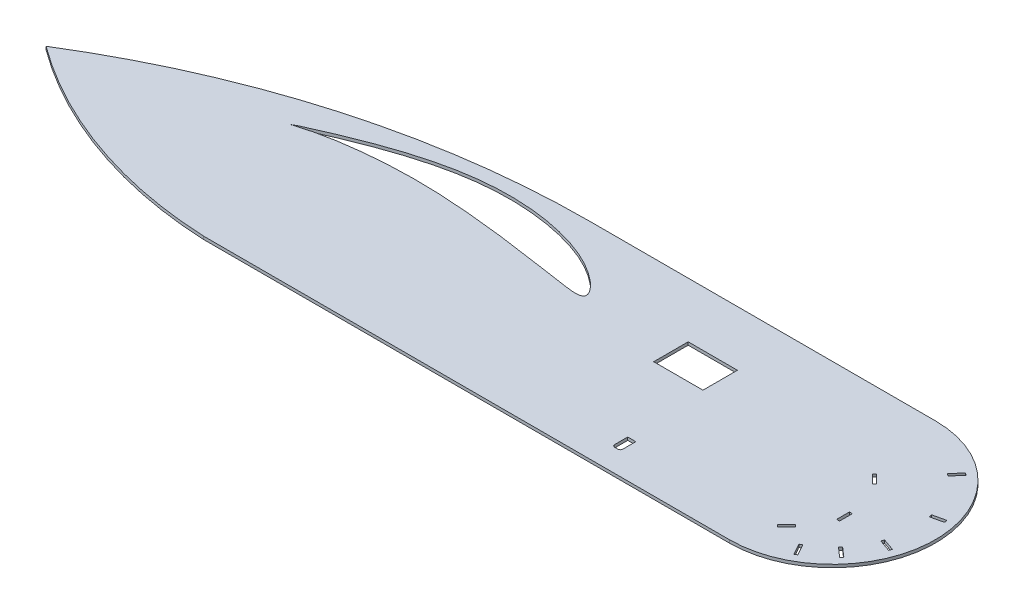
from build123d import *

# Parameters (mm, degrees)
BOSS_EXTRUDE1_DEPTH = 3
SKETCH2_W           = 50
SKETCH2_H           = 35
SKETCH2_W_2         = 3
SKETCH2_H_2         = 13
CUT_EXTRUDE1_DEPTH  = 929.337357861


with BuildPart() as part:
    # Sketch1 → Boss-Extrude1 (new body)
    with BuildSketch(Plane(origin=(0, 0, 0), x_dir=(1, 0, 0), z_dir=(0, 1, 0))):
        with BuildLine():
            Line((266.408252791, 0), (800, 0))
            ThreePointArc((800, 0), (904.5, 104.5), (800, 209))
            Line((800, 209), (449.013868906, 209))
            ThreePointArc((449.013868906, 209), (225.712962473, 177.880412497), (19.429068043, 86.893169221))
            ThreePointArc((19.429068043, 86.893169221), (136.475600537, 25.133273094), (266.408252791, 0))
        make_face()
    extrude(amount=BOSS_EXTRUDE1_DEPTH)

    # Sketch2 → Cut-Extrude1 (cut, through all)
    with BuildSketch(Plane.XZ):
        with Locations((630.07, -135.5)):
            Rectangle(SKETCH2_W, SKETCH2_H)
        Polygon((823.689305431, -121.232773416), (814.496917276, -130.425161571), (816.618237619, -132.546481915), (825.810625775, -123.354093759), align=None)
        Polygon((841.707638324, -32.736946498), (848.035754927, -21.381113624), (845.41517811, -19.920779024), (839.087061507, -31.276611897), align=None)
        with Locations((837.956551938, -78.816857662)):
            Rectangle(SKETCH2_W_2, SKETCH2_H_2)
        with BuildLine():
            Line((212.57, -142.261782597), (212.57, -142.294782597))
            add(Edge.make_bspline(
                [(212.57, -142.294782597), (212.815137814, -142.460102486), (213.721483955, -143.071338431), (215.664179604, -144.220627165), (218.723437449, -145.777902142), (222.783765044, -147.580430449), (227.75908382, -149.780753256), (233.673151887, -152.372942719), (243.334631626, -156.473964415), (254.071597155, -160.928560196), (265.811315632, -165.551386352), (275.559769605, -169.192616013), (285.820264156, -172.789650289), (300.213165162, -177.442893994), (315.047470761, -181.61442891), (330.216772764, -185.078244178), (341.716798025, -187.262793988), (353.238408154, -188.970546018), (364.74982071, -190.189827969), (376.222154657, -190.889317525), (387.611451467, -191.086885836), (398.853751386, -190.764655348), (413.421420996, -189.696341642), (427.580802498, -187.700042396), (441.195366572, -184.827458978), (450.821943115, -182.319735681), (459.948918056, -179.469695278), (468.511745548, -176.287644359), (476.453624938, -172.824739179), (483.715148146, -169.128859345), (490.24814377, -165.284833696), (496.019667562, -161.40694583), (500.998027396, -157.585747413), (505.147593549, -153.884087589), (508.447339472, -150.382728864), (510.852240131, -147.180842115), (512.23052565, -144.518995071), (512.672376723, -142.438033672), (512.365957104, -140.693980261), (510.836297954, -139.267947677), (508.300825673, -138.604557497), (504.990749494, -138.396901122), (500.845143819, -138.632879923), (495.886387834, -139.207005807), (490.127383335, -140.033765729), (483.600688534, -141.01415409), (476.345974836, -142.081971784), (468.41886468, -143.270863791), (459.86962452, -144.552957933), (447.40415706, -146.414008038), (434.302787697, -148.29198326), (413.230560269, -151.080307043), (394.916461571, -153.170522792), (372.413070638, -155.185169178), (353.278576878, -156.497400442), (334.10390548, -157.12050793), (318.83753012, -157.119300437), (307.569298967, -156.863067348), (296.54483902, -156.342386113), (285.853643217, -155.59861473), (275.586288909, -154.654588864), (265.829573747, -153.556930461), (256.673464041, -152.312824912), (248.205041684, -150.95854436), (240.510067524, -149.523302558), (233.666056009, -148.064077742), (227.735558734, -146.629571507), (222.771530443, -145.20558608), (218.774640723, -143.912633605), (215.724793866, -142.995242016), (213.753356987, -142.496728121), (212.816237246, -142.310670921), (212.57, -142.261782597)],
                knots=[0, 0, 0, 0, 0.001413477, 0.005226038, 0.010781091, 0.017815608, 0.026460951, 0.036790889, 0.048685593, 0.076639155, 0.092362872, 0.109003461, 0.126386903, 0.144339126, 0.181312719, 0.200023431, 0.218712626, 0.237261299, 0.255692478, 0.274037197, 0.292192583, 0.310132767, 0.327788163, 0.362001934, 0.378421226, 0.394286639, 0.40954344, 0.424114253, 0.43793778, 0.450941833, 0.463044023, 0.474154417, 0.484164575, 0.493023962, 0.500713088, 0.507125739, 0.512129705, 0.514904185, 0.517171427, 0.520261618, 0.5242453, 0.529497961, 0.536092185, 0.54406114, 0.553363127, 0.563904543, 0.575614949, 0.588420092, 0.60222661, 0.616944448, 0.648675826, 0.665501113, 0.718564132, 0.736789145, 0.773513212, 0.810244924, 0.828488569, 0.846493195, 0.864125178, 0.88124851, 0.897725282, 0.913415058, 0.928184346, 0.941897285, 0.954411455, 0.965602702, 0.975349728, 0.983575522, 0.990284579, 0.99543259, 0.998799869, 1, 1, 1, 1], degree=3))
        make_face()
        with BuildLine():
            Line((658.07, -25.47338103), (658.07, -38.67338103))
            Line((658.07, -38.67338103), (666.27, -38.67338103))
            Line((666.27, -38.67338103), (666.27, -25.47338103))
            ThreePointArc((666.27, -25.47338103), (665.537766953, -23.705614077), (663.77, -22.97338103))
            Line((663.77, -22.97338103), (660.57, -22.97338103))
            ThreePointArc((660.57, -22.97338103), (658.802233047, -23.705614077), (658.07, -25.47338103))
        make_face()
        Polygon((852.614877089, -168.696087508), (861.035840033, -178.599994975), (863.321357141, -176.656695834), (854.900394197, -166.752788367), align=None)
        Polygon((880.568820065, -124.45314952), (893.242023715, -127.349683528), (893.91045464, -124.425098071), (881.23725099, -121.528564063), align=None)
        Polygon((878.844377478, -78.557234485), (891.117636667, -74.271547972), (890.128632087, -71.43925739), (877.855372898, -75.724943903), align=None)
        Polygon((863.610441298, -51.178571845), (873.420639276, -42.648623685), (871.452189701, -40.384731844), (861.641991722, -48.914680004), align=None)
        Polygon((822.408918341, -44.734564453), (813.216530186, -35.542176297), (811.095209842, -37.663496641), (820.287597998, -46.855884796), align=None)
    extrude(amount=-CUT_EXTRUDE1_DEPTH, mode=Mode.SUBTRACT)


solid = part.part
